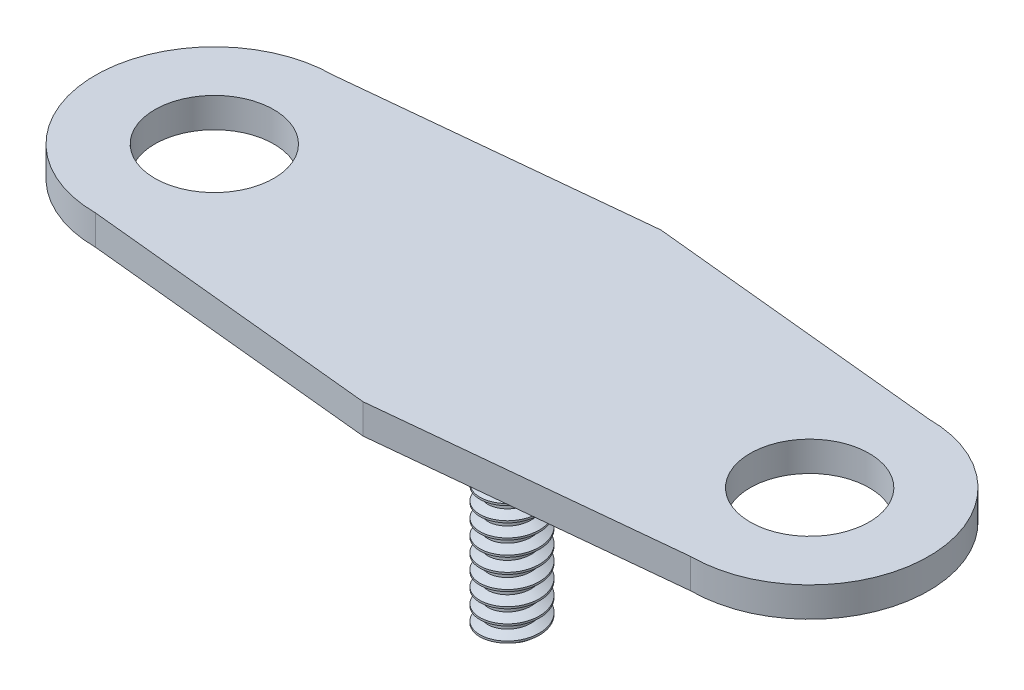
from build123d import *
from build123d.topology import SkipClean

# Parameters (mm, degrees)
SKETCH1_R           = 0.5
BOSS_EXTRUDE1_DEPTH = 4
THREAD1_PITCH       = 0.25
SKETCH2_R           = 1
BOSS_EXTRUDE2_DEPTH = 0.5


with BuildPart() as part:
    # Sketch1 → Boss-Extrude1 (new body)
    with BuildSketch(Plane(origin=(0, 0, 0), x_dir=(1, 0, 0), z_dir=(0, 1, 0))):
        with Locations(Location((0, 0, 0), (0, 0, 270))):
            Circle(SKETCH1_R)
    extrude(amount=BOSS_EXTRUDE1_DEPTH)

    # Thread1: the profile of Thread Profile1 profile screwed along a right-hand helix of 16 turns, 6 arcs to a turn; built about Z, then put on its axis
    thread1_z = Axis((0, 0, 0), (0, 0, 1))
    thread1_corners = [(0.5003, 0, -0.000173205), (0.5003, 0, 0.218923204), (0.364683531, 0, 0.140625), (0.364683531, 0, 0.078125)]
    with BuildLine(mode=Mode.PRIVATE) as thread1_profile:
        Line(thread1_corners[0], thread1_corners[1])
        Line(thread1_corners[1], thread1_corners[2])
        Line(thread1_corners[2], thread1_corners[3])
        Line(thread1_corners[3], thread1_corners[0])
    thread1_cap = Face(thread1_profile.wire())
    thread1_turn_angles = [0, 30, 60, 90, 120, 150, 180, 210, 240, 270, 300, 330, 360]
    thread1_turn_weights = [1, 0.8660254037844387, 1, 0.8660254037844387, 1, 0.8660254037844387, 1, 0.8660254037844387, 1, 0.8660254037844387, 1, 0.8660254037844387, 1]
    thread1_turn_rails = [Edge.make_bspline([Vector(p[0], p[1], 0).rotate(thread1_z, thread1_turn_angles[k]) / thread1_turn_weights[k] + Vector(0, 0, p[2] + THREAD1_PITCH * thread1_turn_angles[k] / 360) for k in range(13)], [0, 0, 0, 1, 1, 2, 2, 3, 3, 4, 4, 5, 5, 6, 6, 6], 2, thread1_turn_weights) for p in thread1_corners]
    thread1_turn_sides = [Face.make_surface_from_curves(thread1_turn_rails[p[0]], thread1_turn_rails[p[1]]) for p in [(0, 1), (1, 2), (2, 3), (3, 0)]]
    thread1 = Plane(origin=(0, 4, 0), x_dir=(-1, 0, 0), z_dir=(0, -1, 0)) * Solid(Shell([*[p.moved(Location((0, 0, THREAD1_PITCH * i))) for i in range(16) for p in thread1_turn_sides], thread1_cap, thread1_cap.rotate(thread1_z, 5760).moved(Location((0, 0, THREAD1_PITCH * 5760 / 360)))]))
    add(thread1, mode=Mode.SUBTRACT)

    # Sketch2 → Boss-Extrude2 (add)
    with SkipClean():  # the faces are left unmerged after this step: merging them gives an invalid solid
        with BuildSketch(Plane(origin=(0, 4, 0), x_dir=(1, 0, 0), z_dir=(0, 1, 0))):
            with BuildLine():
                Line((0, 2.5), (5, 2))
                ThreePointArc((5, 2), (7, 0), (5, -2))
                Line((5, -2), (0, -2.5))
                Line((0, -2.5), (-5, -2))
                ThreePointArc((-5, -2), (-7, 0), (-5, 2))
                Line((-5, 2), (0, 2.5))
            make_face()
            with Locations(Location((-5, 0, 0), (0, 0, 270))):
                Circle(SKETCH2_R, mode=Mode.SUBTRACT)
            with Locations(Location((5, 0, 0), (0, 0, 270))):
                Circle(SKETCH2_R, mode=Mode.SUBTRACT)
        extrude(amount=BOSS_EXTRUDE2_DEPTH)


solid = part.part
